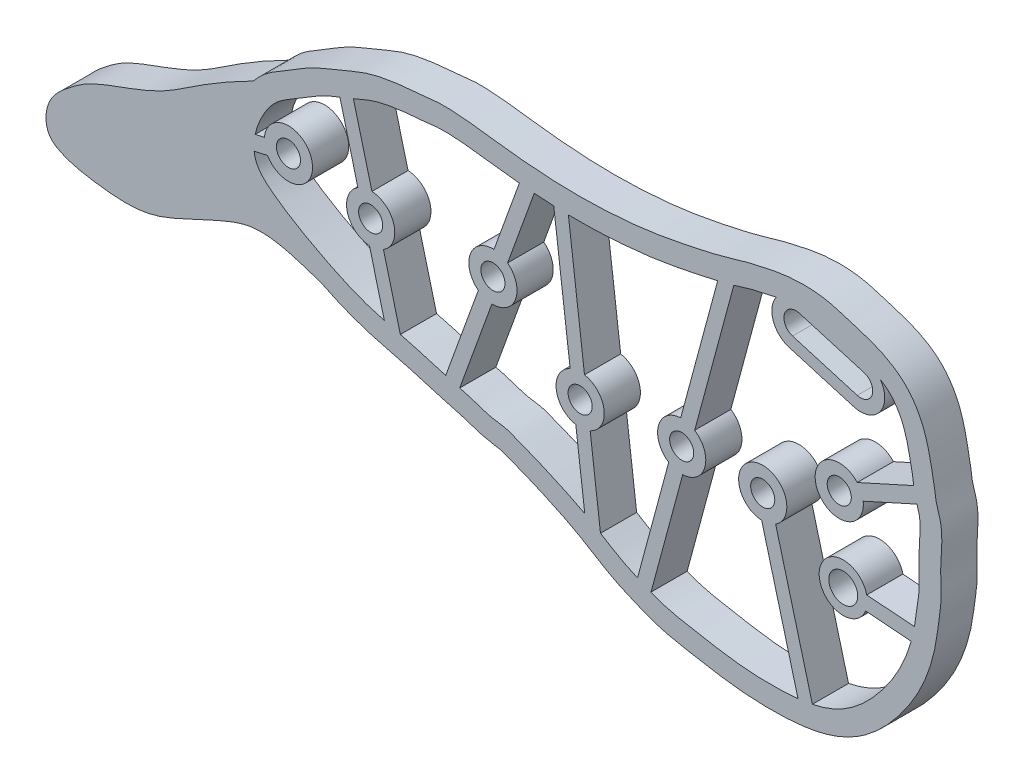
from build123d import *

# Parameters (mm, degrees)
SKETCH1_R           = 1
SKETCH1_R_2         = 1.2
BOSS_EXTRUDE2_DEPTH = 3


with BuildPart() as part:
    # Sketch1 → Boss-Extrude2 (new body)
    with BuildSketch(Plane.XY):
        with BuildLine():
            add(Edge.make_bspline(
                [(-61.194056067, -39.053911589), (-61.122900057, -38.963866602), (-60.786904658, -38.560911725), (-60.00992855, -37.852817537), (-59.003480445, -37.246073809), (-58.174355884, -36.772769635), (-57.327099252, -36.238740499), (-56.35540667, -35.66135915), (-55.216866917, -35.152458018), (-54.286405568, -34.812028793), (-53.431076372, -34.439796518), (-52.429050107, -34.007780979), (-51.255715995, -33.610026962), (-50.071749357, -33.384507888), (-49.045249247, -33.230578357), (-47.828145755, -33.147167352), (-47.12143284, -33.068462338), (-45.839380836, -32.900006373), (-44.653373281, -32.930663695), (-43.568648684, -33.01461399), (-42.157105186, -33.177661456), (-40.509490539, -33.403845956), (-38.545360024, -33.612456224), (-35.94093206, -33.804902845), (-33.340563194, -33.832894429), (-30.756650551, -33.678051185), (-28.794151513, -33.488804917), (-26.920072014, -33.196178819), (-24.950266667, -32.806724177), (-23.349670305, -32.461024841), (-22.265503841, -32.183036418), (-21.649462996, -32.008925624), (-21.209395475, -31.877463318), (-20.70946833, -31.713547895), (-19.878000454, -31.499533225), (-19.141228701, -31.340602421), (-18.028787086, -31.084264266), (-16.522498553, -30.859383902), (-14.928555409, -30.816279827), (-13.481718582, -31.038893243), (-12.630097062, -31.274982312), (-12.133022874, -31.439508337), (-11.641071775, -31.587320169), (-10.892105373, -31.810598932), (-9.867134365, -32.139436087), (-8.567891257, -32.701079375), (-7.251943186, -33.587675734), (-6.207946445, -34.867557457), (-5.559358006, -36.215991163), (-5.24082787, -37.307921777), (-5.059599258, -38.118279873), (-4.942470276, -38.70289265), (-4.858556094, -39.13442909), (-4.776359852, -39.518091384), (-4.6915535, -40.024000382), (-4.639432155, -40.508213848), (-4.581134865, -40.896862992), (-4.482267653, -41.242293302), (-4.281330913, -41.851414392), (-4.120278273, -42.603749583), (-4.074660997, -43.396967897), (-4.117108658, -44.312590413), (-4.178702696, -45.28359228), (-4.199333988, -45.922143371), (-4.160805911, -46.921937766), (-4.150607309, -47.889064192), (-4.224156466, -48.674898147), (-4.293047473, -49.098130962), (-4.340977262, -49.393711969), (-4.399984238, -49.862668025), (-4.482960411, -50.525230204), (-4.595762684, -51.207387585), (-4.778092827, -52.079043066), (-5.185128689, -53.548169326), (-6.014584451, -55.478582768), (-7.340063403, -57.543808702), (-8.997122359, -59.504072782), (-11.088016209, -61.232534578), (-13.707325444, -62.336809017), (-16.294682371, -62.705362225), (-18.682294173, -62.76702155), (-21.128740397, -62.618269445), (-23.078682593, -62.319402154), (-24.577811562, -62.049891002), (-25.688873174, -61.852318013), (-26.886827493, -61.609920851), (-27.955649277, -61.302315773), (-28.763818159, -60.986126793), (-29.289057886, -60.765267196), (-29.791224556, -60.561409915), (-30.356052376, -60.327301192), (-30.951834763, -60.049655806), (-31.695144696, -59.659845141), (-32.562422416, -59.149750555), (-33.529261963, -58.550225406), (-34.725263673, -57.84171359), (-36.296934147, -57.076207611), (-38.008786574, -56.312646995), (-39.304715566, -55.813984606), (-40.305882796, -55.390097629), (-40.653466322, -55.277604183), (-41.043684553, -55.209809435), (-41.681755677, -55.126645), (-42.473969769, -54.928960538), (-43.070529415, -54.716753337), (-43.526200736, -54.559932454), (-43.997111467, -54.424951042), (-44.714816555, -54.236273436), (-45.667463991, -53.970534346), (-47.118242882, -53.540953633), (-48.849380765, -53.028665998), (-51.034512154, -52.526873326), (-53.222917439, -51.811750486), (-54.66605266, -51.161848897), (-55.38305176, -50.817330099), (-55.564813987, -50.728465622)],
                knots=[0.061509283, 0.061509283, 0.061509283, 0.061509283, 0.063462408, 0.0703125, 0.078125, 0.0859375, 0.09375, 0.1015625, 0.109375, 0.1171875, 0.125, 0.1328125, 0.140625, 0.1484375, 0.15625, 0.1640625, 0.171875, 0.1796875, 0.1875, 0.1953125, 0.203125, 0.21875, 0.234375, 0.25, 0.28125, 0.296875, 0.3125, 0.328125, 0.34375, 0.359375, 0.3671875, 0.37109375, 0.375, 0.37890625, 0.3828125, 0.390625, 0.3984375, 0.40625, 0.421875, 0.4296875, 0.43359375, 0.4375, 0.44140625, 0.4453125, 0.453125, 0.4609375, 0.46875, 0.4765625, 0.484375, 0.4921875, 0.49609375, 0.5, 0.50390625, 0.505859375, 0.5078125, 0.51171875, 0.515625, 0.51953125, 0.5234375, 0.52734375, 0.53125, 0.53515625, 0.5390625, 0.546875, 0.5546875, 0.5625, 0.56640625, 0.568359375, 0.5703125, 0.57421875, 0.578125, 0.58203125, 0.5859375, 0.59375, 0.609375, 0.625, 0.640625, 0.65625, 0.671875, 0.6875, 0.703125, 0.71875, 0.734375, 0.7421875, 0.75, 0.7578125, 0.765625, 0.76953125, 0.7734375, 0.77734375, 0.78125, 0.78515625, 0.7890625, 0.796875, 0.8046875, 0.8125, 0.828125, 0.84375, 0.8515625, 0.859375, 0.86328125, 0.8671875, 0.87109375, 0.875, 0.87890625, 0.8828125, 0.88671875, 0.890625, 0.8984375, 0.90625, 0.921875, 0.9375, 0.953125, 0.964598387, 0.968504637, 0.968504637, 0.968504637, 0.968504637], degree=3))
            add(Edge.make_bspline(
                [(-61.194056067, -39.053911589), (-62.625983443, -39.782117613), (-65.208247648, -41.207927678), (-68.839345432, -43.836625902), (-72.315963145, -44.99616078), (-74.989311717, -46.056949571), (-76.781076825, -47.382567236), (-78.474519008, -48.900217936), (-78.467785657, -51.470367992), (-76.487582295, -52.52039994), (-73.889872369, -52.986404927), (-69.801501913, -53.368020358), (-66.606257317, -51.626426159), (-63.716407964, -50.356521847), (-60.481451189, -48.927991213), (-57.324315582, -50.149952512), (-55.564813987, -50.728465622)],
                knots=[0, 0, 0, 0, 0.105045838, 0.193260654, 0.291013929, 0.343614403, 0.380042558, 0.436980025, 0.487582193, 0.515276092, 0.574688612, 0.662804361, 0.775463445, 0.804074948, 0.870737703, 1, 1, 1, 1], degree=3))
        make_face()
        with BuildLine():
            Line((-51.55756281, -46.057859366), (-50.321628608, -50.817299728))
            add(Edge.make_bspline(
                [(-50.321628608, -50.817299728), (-50.829579923, -50.682594113), (-51.998973304, -50.347799223), (-54.837791691, -49.161154752), (-57.660416327, -47.624103177), (-59.877215865, -46.079923146), (-60.914838531, -45.143410981), (-61.096020616, -44.250203792), (-61.115325292, -44.056369829)],
                knots=[0.935535857, 0.935535857, 0.935535857, 0.935535857, 0.946461202, 0.960888988, 1, 1.008418225, 1.024991907, 1.029456568, 1.029456568, 1.029456568, 1.029456568], degree=3))
            Line((-61.115325292, -44.056369829), (-60.005038699, -43.807120701))
            ThreePointArc((-60.005038699, -43.807120701), (-56.324851813, -42.366019586), (-60.267885832, -42.63626145))
            Line((-60.267885832, -42.63626145), (-61.032118191, -42.807824586))
            add(Edge.make_bspline(
                [(-61.032118191, -42.807824586), (-60.893432883, -42.131129315), (-60.42899255, -41.042327102), (-59.277347111, -39.425068122), (-57.33093049, -38.417496572), (-55.6078702, -37.240497943), (-54.398782668, -36.777483299), (-54.006930979, -36.625624461)],
                knots=[0.038991333, 0.038991333, 0.038991333, 0.038991333, 0.054839244, 0.065896336, 0.084165811, 0.104394653, 0.114083256, 0.114083256, 0.114083256, 0.114083256], degree=3))
            Line((-54.006930979, -36.625624461), (-52.516270301, -42.365987161))
            ThreePointArc((-52.516270301, -42.365987161), (-53.39131032, -44.563633013), (-51.55756281, -46.057859366))
        make_face(mode=Mode.SUBTRACT)
        with BuildLine():
            Line((-51.354792991, -42.064374067), (-52.886508954, -36.165912189))
            add(Edge.make_bspline(
                [(-52.886508954, -36.165912189), (-52.255758296, -35.893688919), (-51.046267343, -35.360464887), (-49.535112373, -35.122172896), (-48.307243489, -34.965960399), (-47.299534455, -34.931231662), (-45.979275858, -34.696988474), (-43.965342756, -34.742046733), (-41.654168641, -35.07775382), (-39.858280392, -35.283941089), (-39.126979603, -35.355158959)],
                knots=[0.123382576, 0.123382576, 0.123382576, 0.123382576, 0.139207419, 0.153885524, 0.158465695, 0.167836402, 0.177147849, 0.189373262, 0.214162697, 0.231144836, 0.231144836, 0.231144836, 0.231144836], degree=3))
            Line((-39.126979603, -35.355158959), (-41.231192381, -41.16735827))
            ThreePointArc((-41.231192381, -41.16735827), (-43.196155188, -42.484272652), (-42.529632355, -44.753873858))
            Line((-42.529632355, -44.753873858), (-45.232412091, -52.219418543))
            add(Edge.make_bspline(
                [(-45.232412091, -52.219418543), (-46.266739729, -51.920273656), (-47.510335853, -51.535832972), (-48.77535472, -51.211502557), (-48.993833979, -51.156155486)],
                knots=[0.898962547, 0.898962547, 0.898962547, 0.898962547, 0.921379228, 0.926054257, 0.926054257, 0.926054257, 0.926054257], degree=3))
            Line((-48.993833979, -51.156155486), (-50.3960855, -45.756246272))
            ThreePointArc((-50.3960855, -45.756246272), (-49.521045482, -43.55860042), (-51.354792991, -42.064374067))
        make_face(mode=Mode.SUBTRACT)
        with Locations((-51.456177901, -44.061116717)):
            Circle(SKETCH1_R, mode=Mode.SUBTRACT)
        with BuildLine():
            add(Edge.make_bspline(
                [(-33.701574079, -56.373878361), (-34.716527389, -55.819696073), (-36.136547352, -55.175539869), (-37.935691728, -54.402528025), (-39.058192294, -53.978741946), (-40.218774221, -53.458363286), (-41.566364691, -53.375884044), (-42.819510708, -52.870953595), (-43.673578677, -52.64939876), (-44.073256511, -52.542771938)],
                knots=[0.813640022, 0.813640022, 0.813640022, 0.813640022, 0.837687832, 0.846032736, 0.854360406, 0.862697319, 0.872259041, 0.882003653, 0.890611946, 0.890611946, 0.890611946, 0.890611946], degree=3))
            Line((-44.073256511, -52.542771938), (-41.401300645, -45.162368108))
            ThreePointArc((-41.401300645, -45.162368108), (-39.436337838, -43.845453727), (-40.102860671, -41.575852521))
            Line((-40.102860671, -41.575852521), (-37.889750329, -35.462859319))
            add(Edge.make_bspline(
                [(-37.889750329, -35.462859319), (-37.496248238, -35.49284046), (-36.95781296, -35.528021583), (-36.418816982, -35.554170511), (-36.274021209, -35.56053517)],
                knots=[0.240713182, 0.240713182, 0.240713182, 0.240713182, 0.249834871, 0.253184375, 0.253184375, 0.253184375, 0.253184375], degree=3))
            Line((-36.274021209, -35.56053517), (-34.913680083, -46.566882546))
            ThreePointArc((-34.913680083, -46.566882546), (-36.068490508, -48.631284446), (-34.445805201, -50.352398828))
            Line((-34.445805201, -50.352398828), (-33.701574079, -56.373878361))
        make_face(mode=Mode.SUBTRACT)
        with BuildLine():
            add(Edge.make_bspline(
                [(-29.326600138, -58.804932077), (-29.497869267, -58.733335355), (-30.568666656, -58.272114621), (-31.55882775, -57.648488399), (-32.398278627, -57.135752187)],
                knots=[0.778908076, 0.778908076, 0.778908076, 0.778908076, 0.782770016, 0.803185723, 0.803185723, 0.803185723, 0.803185723], degree=3))
            Line((-32.398278627, -57.135752187), (-33.254867101, -50.205203576))
            ThreePointArc((-33.254867101, -50.205203576), (-32.100056676, -48.140801676), (-33.722741983, -46.419687294))
            Line((-33.722741983, -46.419687294), (-35.06022202, -35.59830609))
            add(Edge.make_bspline(
                [(-35.06022202, -35.59830609), (-34.31675102, -35.6118162), (-33.377104129, -35.606353463), (-31.989235566, -35.553986577), (-30.888681612, -35.488679717), (-29.580808871, -35.371437263), (-27.643342783, -35.15780752), (-25.359873335, -34.730077136), (-23.484856168, -34.33660716), (-22.677861939, -34.141696104)],
                knots=[0.262539251, 0.262539251, 0.262539251, 0.262539251, 0.279723295, 0.284249287, 0.294647384, 0.305205595, 0.314605533, 0.339694174, 0.358901091, 0.358901091, 0.358901091, 0.358901091], degree=3))
            Line((-22.677861939, -34.141696104), (-25.746720073, -45.525506094))
            ThreePointArc((-25.746720073, -45.525506094), (-27.594214026, -47.002702227), (-26.739544598, -49.208350089))
            Line((-26.739544598, -49.208350089), (-29.326600138, -58.804932077))
        make_face(mode=Mode.SUBTRACT)
        with BuildLine():
            add(Edge.make_bspline(
                [(-16.017972483, -60.821563745), (-16.209485948, -60.842943521), (-16.761263614, -60.89386698), (-17.45738343, -60.925530561), (-18.450390865, -60.93967141), (-19.983011157, -60.912707914), (-22.161696726, -60.66099592), (-24.802454275, -60.178394869), (-26.827825105, -59.818466058), (-27.977238564, -59.360885447), (-28.208066869, -59.266041756)],
                knots=[0.684743352, 0.684743352, 0.684743352, 0.684743352, 0.688720491, 0.696193702, 0.699273238, 0.709375305, 0.728070074, 0.744780937, 0.765338705, 0.770526623, 0.770526623, 0.770526623, 0.770526623], degree=3))
            Line((-28.208066869, -59.266041756), (-25.580907598, -49.520696534))
            ThreePointArc((-25.580907598, -49.520696534), (-23.733413645, -48.043500401), (-24.588083073, -45.837852539))
            Line((-24.588083073, -45.837852539), (-21.340729526, -33.791920752))
            add(Edge.make_bspline(
                [(-21.340729526, -33.791920752), (-21.113370648, -33.727320053), (-20.681619661, -33.599099018), (-19.981167547, -33.371324186), (-19.07653807, -33.176676236), (-18.326720718, -32.992771616), (-17.861519172, -32.900111555), (-17.819333667, -32.891891629)],
                knots=[0.369559397, 0.369559397, 0.369559397, 0.369559397, 0.375025142, 0.379970152, 0.386561709, 0.39648446, 0.397474399, 0.397474399, 0.397474399, 0.397474399], degree=3))
            ThreePointArc((-17.819333667, -32.891891629), (-18.076653097, -34.703725269), (-16.752088427, -35.966453609))
            Line((-16.752088427, -35.966453609), (-11.388299915, -37.545585318))
            ThreePointArc((-11.388299915, -37.545585318), (-9.19777901, -36.791979559), (-9.188229866, -34.475470918))
            add(Edge.make_bspline(
                [(-9.188229866, -34.475470918), (-8.911386809, -34.647021387), (-8.155723837, -35.216564803), (-7.064960828, -36.942347809), (-6.787869597, -38.711398115), (-6.495376248, -40.093089606), (-6.45651198, -40.466160117), (-6.422944896, -40.725056729)],
                knots=[0.462896674, 0.462896674, 0.462896674, 0.462896674, 0.469592018, 0.482500714, 0.5040008, 0.5064167, 0.511856122, 0.511856122, 0.511856122, 0.511856122], degree=3))
            Line((-6.422944896, -40.725056729), (-11.10720983, -42.846264389))
            ThreePointArc((-11.10720983, -42.846264389), (-14.418313263, -45.004305629), (-10.612194746, -43.939406679))
            Line((-10.612194746, -43.939406679), (-6.153085375, -41.920157749))
            add(Edge.make_bspline(
                [(-6.153085375, -41.920157749), (-6.112147791, -42.050930681), (-5.938128897, -42.60237619), (-5.856693497, -43.21307599), (-5.954169854, -44.844023923), (-6.037801364, -46.299333731), (-5.87978281, -47.738839088), (-6.140874321, -49.206261935), (-6.226327922, -50.031726774), (-6.32773412, -50.647005839), (-6.360040002, -50.822991357)],
                knots=[0.520264994, 0.520264994, 0.520264994, 0.520264994, 0.52310444, 0.532522123, 0.536639379, 0.545132913, 0.566484196, 0.569736842, 0.578233294, 0.581710466, 0.581710466, 0.581710466, 0.581710466], degree=3))
            Line((-6.360040002, -50.822991357), (-10.318372018, -50.526352942))
            ThreePointArc((-10.318372018, -50.526352942), (-14.258762094, -50.832741553), (-10.408048863, -51.722997443))
            Line((-10.408048863, -51.722997443), (-6.63059842, -52.006080548))
            add(Edge.make_bspline(
                [(-6.63059842, -52.006080548), (-7.088854787, -53.664675299), (-8.627575964, -56.611789917), (-11.772771304, -59.766624996), (-14.163084678, -60.496665622), (-14.825927938, -60.634467333)],
                knots=[0.589775384, 0.589775384, 0.589775384, 0.589775384, 0.624863979, 0.662471395, 0.676446008, 0.676446008, 0.676446008, 0.676446008], degree=3))
            Line((-14.825927938, -60.634467333), (-17.872396226, -49.211244444))
            ThreePointArc((-17.872396226, -49.211244444), (-19.458771439, -45.591304994), (-19.031871191, -49.520465733))
            Line((-19.031871191, -49.520465733), (-16.017972483, -60.821563745))
        make_face(mode=Mode.SUBTRACT)
        with Locations((-41.316246513, -43.164863189)):
            Circle(SKETCH1_R, mode=Mode.SUBTRACT)
        with Locations((-34.084273592, -48.386043061)):
            Circle(SKETCH1_R, mode=Mode.SUBTRACT)
        with Locations((-25.663813836, -47.523101314)):
            Circle(SKETCH1_R, mode=Mode.SUBTRACT)
        with Locations((-18.94357916, -47.523101314)):
            Circle(SKETCH1_R, mode=Mode.SUBTRACT)
        with Locations((-12.265037767, -50.982151765)):
            Circle(SKETCH1_R_2, mode=Mode.SUBTRACT)
        with Locations((-12.597033531, -44.179563098)):
            Circle(SKETCH1_R, mode=Mode.SUBTRACT)
        with Locations((-58.275615444, -42.803948079)):
            Circle(SKETCH1_R, mode=Mode.SUBTRACT)
        with BuildLine():
            Line((-15.904825619, -33.088581872), (-10.541037107, -34.667713581))
            ThreePointArc((-10.541037107, -34.667713581), (-9.864167464, -35.909425096), (-11.105878979, -36.586294739))
            Line((-11.105878979, -36.586294739), (-16.469667491, -35.00716303))
            ThreePointArc((-16.469667491, -35.00716303), (-17.146537134, -33.765451515), (-15.904825619, -33.088581872))
        make_face(mode=Mode.SUBTRACT)
    extrude(amount=BOSS_EXTRUDE2_DEPTH)


solid = part.part
